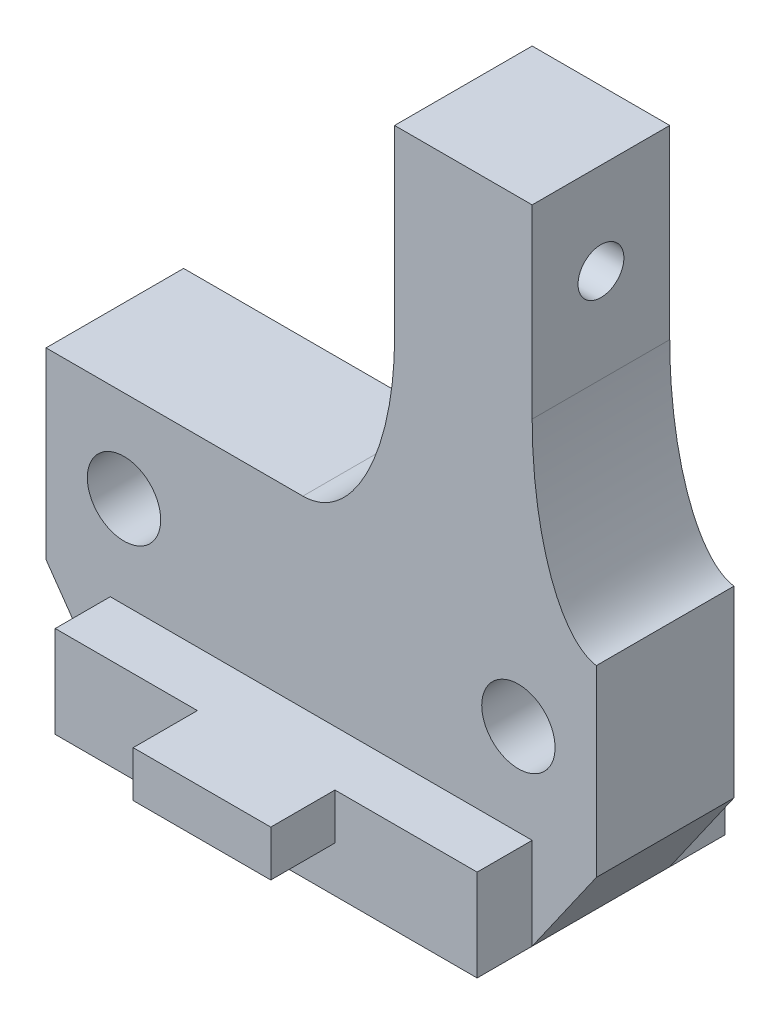
from build123d import *

# Parameters (mm, degrees)
SKETCH1_W           = 46
SKETCH1_H           = 27
BOSS_EXTRUDE1_DEPTH = 10
SKETCH2_W           = 60
SKETCH2_H           = 15
BOSS_EXTRUDE2_DEPTH = 20
SKETCH3_R           = 4
CUT_EXTRUDE2_DEPTH  = 65.420493634
SKETCH6_W           = 15
SKETCH6_H           = 5
BOSS_EXTRUDE4_DEPTH = 7
BOSS_EXTRUDE5_START = -21
BOSS_EXTRUDE5_DEPTH = 15
BOSS_EXTRUDE6_START = -21
BOSS_EXTRUDE6_DEPTH = 15
SKETCH12_W          = 15
SKETCH12_H          = 15
BOSS_EXTRUDE8_DEPTH = 40
SKETCH13_R          = 2.5
CUT_EXTRUDE4_DEPTH  = 40
FILLET1_START       = -21
FILLET1_DEPTH       = 15


with BuildPart() as part:
    # Sketch1 → Boss-Extrude1 (new body)
    with BuildSketch(Plane(origin=(0, 0, 0), x_dir=(1, 0, 0), z_dir=(0, 1, 0))):
        with Locations((23, 13.5)):
            Rectangle(SKETCH1_W, SKETCH1_H)
    extrude(amount=BOSS_EXTRUDE1_DEPTH)

    # Sketch2 → Boss-Extrude2 (add)
    with BuildSketch(Plane(origin=(0, 10, 0), x_dir=(1, 0, 0), z_dir=(0, 1, 0))):
        with Locations((23, 13.5)):
            Rectangle(SKETCH2_W, SKETCH2_H)
    extrude(amount=BOSS_EXTRUDE2_DEPTH)

    # Sketch3 → Cut-Extrude2 (cut, through all)
    with BuildSketch(Plane(origin=(0, 0, -21), x_dir=(-1, 0, 0), z_dir=(0, 0, -1))):
        with Locations((-44.5, 20)):
            Circle(SKETCH3_R)
        with Locations((-1.5, 20)):
            Circle(SKETCH3_R)
    extrude(amount=-CUT_EXTRUDE2_DEPTH, mode=Mode.SUBTRACT)

    # Sketch6 → Boss-Extrude4 (add)
    with BuildSketch(Plane.XY):
        with Locations((23, 7.5)):
            Rectangle(SKETCH6_W, SKETCH6_H)
    extrude(amount=BOSS_EXTRUDE4_DEPTH)

    # Boss-Extrude5: read off the stored shape, not the designer's step
    # Boss-Extrude5 outline → Boss-Extrude5 (add)
    with BuildSketch(Plane.XY.offset(BOSS_EXTRUDE5_START)):
        Polygon((-7, 10), (0, 0), (0, 10), align=None)
    extrude(amount=BOSS_EXTRUDE5_DEPTH)

    # Boss-Extrude6: read off the stored shape, not the designer's step
    # Boss-Extrude6 outline → Boss-Extrude6 (add)
    with BuildSketch(Plane.XY.offset(BOSS_EXTRUDE6_START)):
        Polygon((46, 0), (53, 10), (46, 10), align=None)
    extrude(amount=BOSS_EXTRUDE6_DEPTH)

    # Sketch12 → Boss-Extrude8 (add)
    with BuildSketch(Plane(origin=(0, 30, 0), x_dir=(1, 0, 0), z_dir=(0, 1, 0))):
        with Locations((38.5, 13.5)):
            Rectangle(SKETCH12_W, SKETCH12_H)
    extrude(amount=BOSS_EXTRUDE8_DEPTH)

    # Sketch13 → Cut-Extrude4 (cut)
    with BuildSketch(Plane(origin=(46, 0, 0), x_dir=(0, 0, -1), z_dir=(1, 0, 0))):
        with Locations((13.5, 60)):
            Circle(SKETCH13_R)
    extrude(amount=-CUT_EXTRUDE4_DEPTH, mode=Mode.SUBTRACT)

    # Fillet1: read off the stored shape, not the designer's step
    # Fillet1 outline → Fillet1 (add)
    with BuildSketch(Plane.XY.offset(FILLET1_START)):
        with BuildLine():
            Line((31, 30), (31, 50))
            add(Edge.make_bspline(
                [(31, 50), (31, 30), (21, 30)],
                knots=[0, 0, 0, 1, 1, 1], degree=2, weights=[1, 0.707106781, 1]))
            Line((21, 30), (31, 30))
        make_face()
        with BuildLine():
            add(Edge.make_bspline(
                [(46, 49.773719933), (46, 31.062015649), (53, 30)],
                knots=[0, 0, 0, 1, 1, 1], degree=2, weights=[1, 0.758287544, 1]))
            Line((46, 49.773719933), (46, 30))
            Line((46, 30), (53, 30))
        make_face()
    extrude(amount=FILLET1_DEPTH)


solid = part.part
